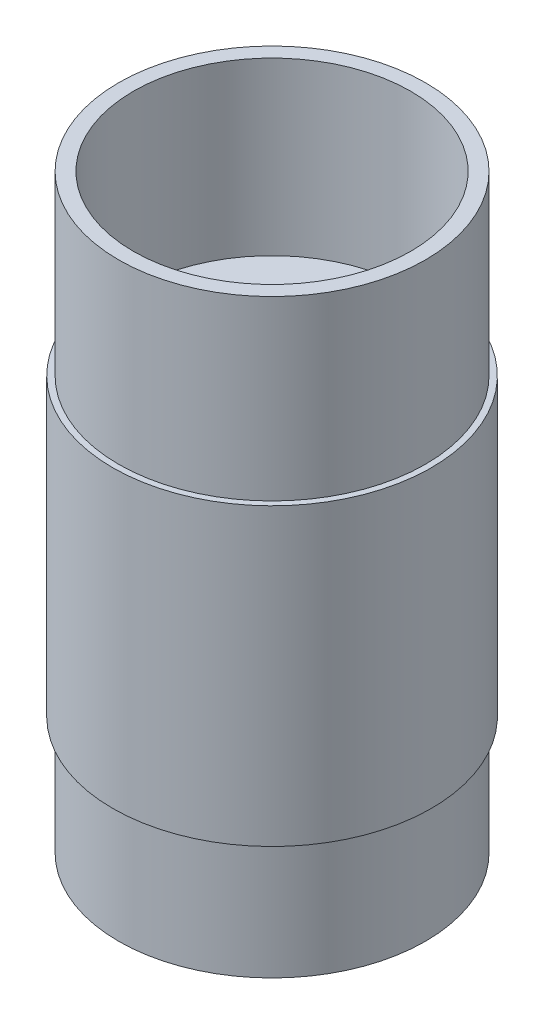
from build123d import *

# Parameters (mm, degrees)
ESBO_O1_R                = 26
ESBO_O1_R_2              = 23.5
RESSALTO_EXTRUS_O1_DEPTH = 20
ESBO_O2_R                = 27
ESBO_O2_R_2              = 25
RESSALTO_EXTRUS_O2_DEPTH = 50
ESBO_O3_R                = 26
ESBO_O3_R_2              = 23.5
RESSALTO_EXTRUS_O3_DEPTH = 30
ESBO_O18_R               = 24
RESSALTO_EXTRUS_O4_DEPTH = 1


with BuildPart() as part:
    # Esboço1 → Ressalto-extrusão1 (new body)
    with BuildSketch(Plane(origin=(0, 0, 0), x_dir=(1, 0, 0), z_dir=(0, 1, 0))):
        Circle(ESBO_O1_R)
        Circle(ESBO_O1_R_2, mode=Mode.SUBTRACT)
    extrude(amount=RESSALTO_EXTRUS_O1_DEPTH)


with BuildPart() as body_2:
    # Esboço2 → Ressalto-extrusão2 (new body)
    with BuildSketch(Plane(origin=(0, 20, 0), x_dir=(1, 0, 0), z_dir=(0, 1, 0))):
        Circle(ESBO_O2_R)
        Circle(ESBO_O2_R_2, mode=Mode.SUBTRACT)
    extrude(amount=RESSALTO_EXTRUS_O2_DEPTH)


with BuildPart() as body_3:
    # Esboço3 → Ressalto-extrusão3 (new body)
    with BuildSketch(Plane(origin=(0, 70, 0), x_dir=(1, 0, 0), z_dir=(0, 1, 0))):
        Circle(ESBO_O3_R)
        Circle(ESBO_O3_R_2, mode=Mode.SUBTRACT)
    extrude(amount=RESSALTO_EXTRUS_O3_DEPTH)

    # Esboço18 → Ressalto-extrusão4 (add)
    with BuildSketch(Plane(origin=(0, 70, 0), x_dir=(1, 0, 0), z_dir=(0, 1, 0))):
        Circle(ESBO_O18_R)
    extrude(amount=RESSALTO_EXTRUS_O4_DEPTH)


solid = Compound([part.part, body_2.part, body_3.part])
